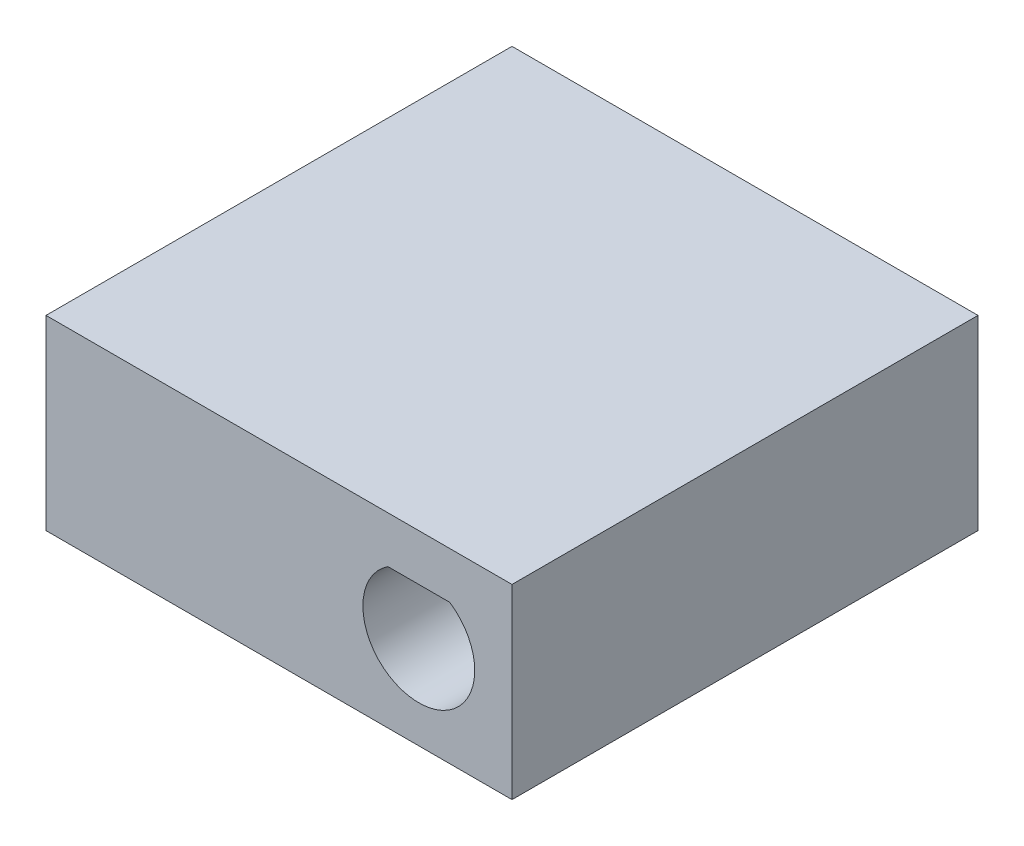
from build123d import *

# Parameters (mm, degrees)
SKETCH1_W           = 25
SKETCH1_H           = 25
BOSS_EXTRUDE1_DEPTH = 10
CUT_EXTRUDE1_DEPTH  = 10


with BuildPart() as part:
    # Sketch1 → Boss-Extrude1 (new body)
    with BuildSketch(Plane(origin=(0, 0, 0), x_dir=(1, 0, 0), z_dir=(0, 1, 0))):
        Rectangle(SKETCH1_W, SKETCH1_H)
    extrude(amount=BOSS_EXTRUDE1_DEPTH)

    # Sketch2 → Cut-Extrude1 (cut)
    with BuildSketch(Plane.XY.offset(12.5)):
        with BuildLine():
            Line((5.841687605, 7.5), (9.158312395, 7.5))
            ThreePointArc((9.158312395, 7.5), (7.5, 2), (5.841687605, 7.5))
        make_face()
    extrude(amount=-CUT_EXTRUDE1_DEPTH, mode=Mode.SUBTRACT)


solid = part.part
